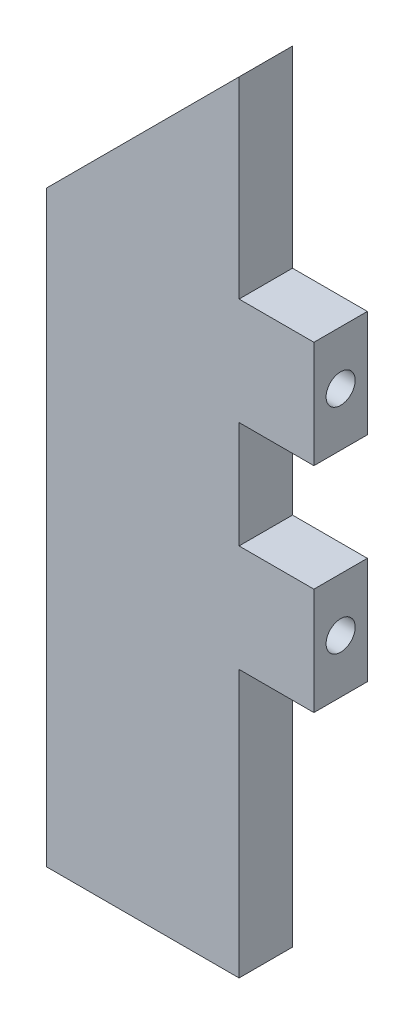
from build123d import *

# Parameters (mm, degrees)
SKETCH1_W                 = 31.75
SKETCH1_H                 = 6.35
BOSS_EXTRUDE1_DEPTH       = 101.6
CHAMFER1_SIZE             = 31.75
F_8_32_TAPPED_HOLE1_D     = 3.4544
F_8_32_TAPPED_HOLE1_DEPTH = 6.35
F_8_32_TAPPED_HOLE1_TIP   = 1.037806461
SKETCH4_W                 = 8.89
SKETCH4_H                 = 31.75
SKETCH4_H_2               = 12.7
CUT_EXTRUDE1_DEPTH        = 107.634633211


with BuildPart() as part:
    # Sketch1 → Boss-Extrude1 (new body)
    with BuildSketch(Plane(origin=(0, 0, 0), x_dir=(1, 0, 0), z_dir=(0, 1, 0))):
        with Locations((15.875, 3.175)):
            Rectangle(SKETCH1_W, SKETCH1_H)
    extrude(amount=BOSS_EXTRUDE1_DEPTH)

    # Chamfer1
    chamfer1_edges = [part.edges().sort_by_distance(p)[0] for p in [
        (0, 101.6, -3.175),
    ]]
    chamfer(chamfer1_edges, length=CHAMFER1_SIZE - 0.0001)  # a hair under: the kernel refuses the full size

    # #8-32 Tapped Hole1
    with Locations(Plane(origin=(31.75, 0, 0), x_dir=(0, 0, -1), z_dir=(1, 0, 0))):
        with Locations((3.175, 63.5), (3.175, 38.1)):
            Hole(F_8_32_TAPPED_HOLE1_D / 2, depth=F_8_32_TAPPED_HOLE1_DEPTH)
            with Locations((0, 0, -(F_8_32_TAPPED_HOLE1_DEPTH + F_8_32_TAPPED_HOLE1_TIP / 2))):  # 118° drill point
                Cone(0, F_8_32_TAPPED_HOLE1_D / 2, F_8_32_TAPPED_HOLE1_TIP, mode=Mode.SUBTRACT)

    # Sketch4 → Cut-Extrude1 (cut, through all)
    with BuildSketch(Plane.XY):
        with Locations((27.305, 15.875)):
            Rectangle(SKETCH4_W, SKETCH4_H)
        with Locations((27.305, 50.8)):
            Rectangle(SKETCH4_W, SKETCH4_H_2)
        with Locations((27.305, 85.725)):
            Rectangle(SKETCH4_W, SKETCH4_H)
    extrude(amount=-CUT_EXTRUDE1_DEPTH, mode=Mode.SUBTRACT)


solid = part.part
